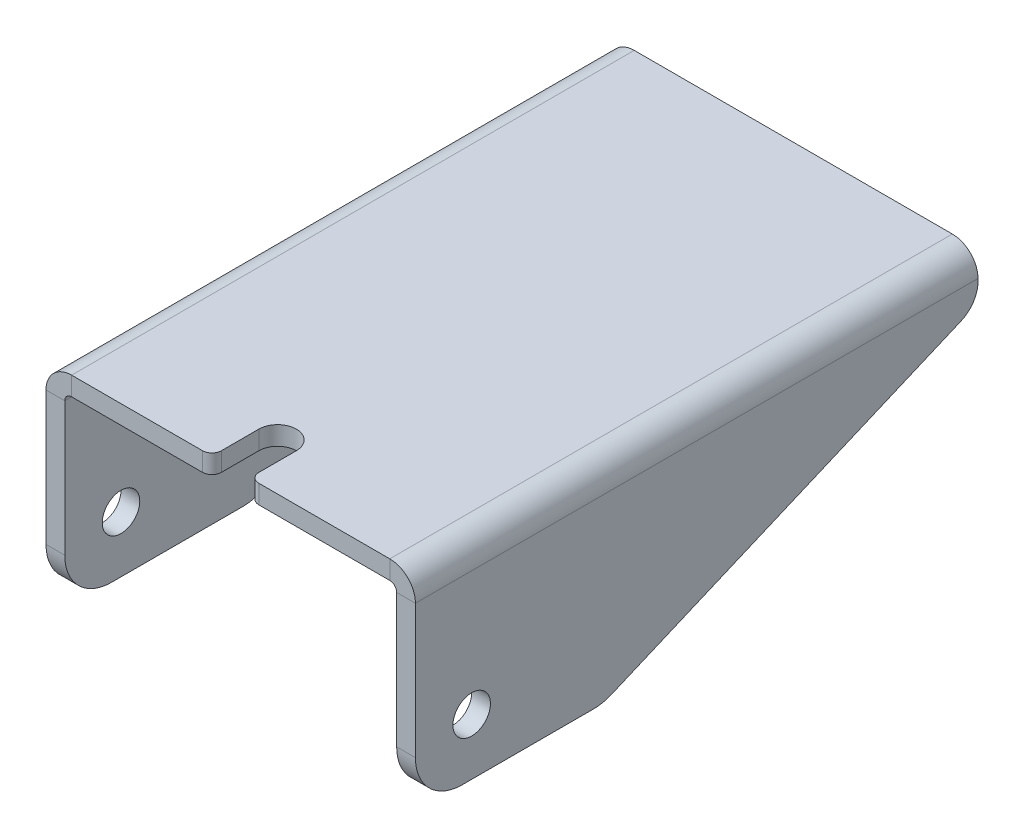
from build123d import *

# Parameters (mm, degrees)
SKETCH1_W                    = 17.7
SKETCH1_H                    = 60
BASE_FLANGE2_DEPTH           = 2
EDGE_FLANGE2_STRIP_W         = 9.4732
EDGE_FLANGE2_STRIP_H         = 2
EDGE_FLANGE2_STRIP_CUT_DEPTH = 60
EDGE_FLANGE2_DEPTH           = 60
CUT_EXTRUDE5_DEPTH           = 2
FILLET4_R                    = 5
FILLET5_R                    = 3
SKETCH22_R                   = 2
CUT_EXTRUDE6_DEPTH           = 2
CUT_EXTRUDE7_DEPTH           = 2
FILLET6_R                    = 1


# Sheet-metal steps are written as plain solids
with BuildPart() as part:
    # Sketch1 → Base-Flange2 (new body)
    with BuildSketch(Plane(origin=(0, 0, 0), x_dir=(1, 0, 0), z_dir=(0, 1, 0))):
        with Locations((-8.85, -30)):
            Rectangle(SKETCH1_W, SKETCH1_H)
    extrude(amount=-BASE_FLANGE2_DEPTH)

    # Edge-Flange2 strip (across the edge) → Edge-Flange2 strip cut (cut)
    with BuildSketch(Plane(origin=(-17.7, -2, 60), x_dir=(1, 0, 0), z_dir=(0, 0, -1))):
        with Locations((-4, -1)):
            Rectangle(EDGE_FLANGE2_STRIP_W, EDGE_FLANGE2_STRIP_H)
    extrude(amount=EDGE_FLANGE2_STRIP_CUT_DEPTH, mode=Mode.SUBTRACT)

    # Edge-Flange2 section (across the edge) → Edge-Flange2 (add)
    with BuildSketch(Plane(origin=(-17.7, -2, 60), x_dir=(1, 0, 0), z_dir=(0, 0, -1))):
        with BuildLine():
            Line((-2, 0.7366), (-2, 20))
            Line((-2, 20), (0, 20))
            Line((0, 20), (0, 0.7366))
            ThreePointArc((0, 0.7366), (0.215745145, 0.215745145), (0.7366, 0))
            Line((0.7366, 0), (0.7366, -2))
            ThreePointArc((0.7366, -2), (-1.198468417, -1.198468417), (-2, 0.7366))
        make_face()
    extrude(amount=EDGE_FLANGE2_DEPTH)

    # Sketch20 → Cut-Extrude5 (cut)
    with BuildSketch(Plane.ZY.offset(19.7)):
        Polygon((0, -5), (40, -22), (0, -22), align=None)
    extrude(amount=-CUT_EXTRUDE5_DEPTH, mode=Mode.SUBTRACT)

    # Fillet4
    fillet4_edges = [part.edges().sort_by_distance(p)[0] for p in [
        (-18.7, -22, 60),
        (-18.7, -22, 40),
    ]]
    fillet(fillet4_edges, radius=FILLET4_R)

    # Fillet5
    fillet5_edges = [part.edges().sort_by_distance(p)[0] for p in [
        (-18.7, -5, 0),
    ]]
    fillet(fillet5_edges, radius=FILLET5_R)

    # Sketch22 → Cut-Extrude6 (cut)
    with BuildSketch(Plane.ZY.offset(19.7)):
        with Locations(Location((54, -16, 0), (0, 0, 270))):
            Circle(SKETCH22_R)
    extrude(amount=-CUT_EXTRUDE6_DEPTH, mode=Mode.SUBTRACT)

    # Mirror1: part across plane


with BuildPart() as part_1:
    add(part.part)
    add(part.part.mirror(Plane(origin=(0, -2, 60), x_dir=(0, 0, 1), z_dir=(1, 0, 0))))

    # Sketch28 → Cut-Extrude7 (cut)
    with BuildSketch(Plane(origin=(0, 0, 0), x_dir=(1, 0, 0), z_dir=(0, 1, 0))):
        with BuildLine():
            Line((2, -55), (2, -60))
            Line((2, -60), (-2, -60))
            Line((-2, -60), (-2, -55))
            ThreePointArc((-2, -55), (0, -53), (2, -55))
        make_face()
    extrude(amount=-CUT_EXTRUDE7_DEPTH, mode=Mode.SUBTRACT)

    # Fillet6
    fillet6_edges = [part_1.edges().sort_by_distance(p)[0] for p in [
        (2, -1, 60),
        (-2, -1, 60),
    ]]
    fillet(fillet6_edges, radius=FILLET6_R)


solid = part_1.part
